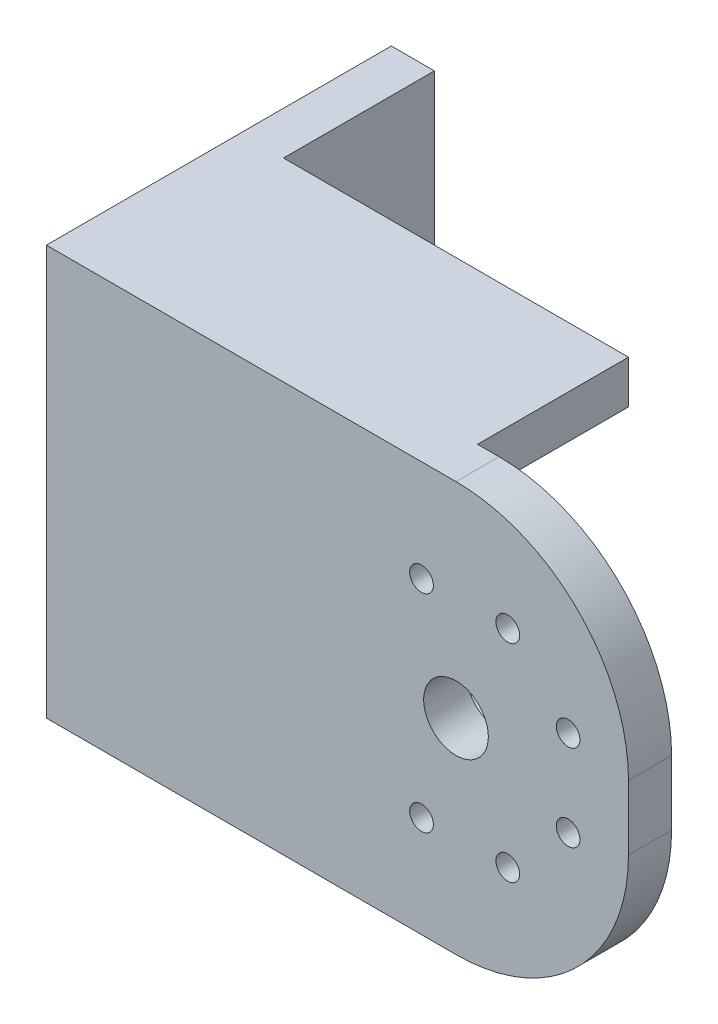
from build123d import *

# Parameters (mm, degrees)
SKETCH3_R           = 7.5
SKETCH3_R_2         = 2.75
BOSS_EXTRUDE1_DEPTH = 10
SKETCH4_W           = 10
SKETCH4_H           = 95
BOSS_EXTRUDE2_DEPTH = 70
SKETCH5_W           = 80
SKETCH5_H           = 10
BOSS_EXTRUDE3_DEPTH = 35
SKETCH8_R           = 7.5
SKETCH8_R_2         = 2.75
CUT_EXTRUDE2_DEPTH  = 43.8


with BuildPart() as part:
    # Sketch3 → Boss-Extrude1 (new body)
    with BuildSketch(Plane.XY):
        with BuildLine():
            Line((68.617133813, 80.05993294), (163.617133813, 80.05993294))
            ThreePointArc((163.617133813, 80.05993294), (191.90140506, 68.344204188), (203.617133813, 40.05993294))
            Line((203.617133813, 40.05993294), (203.617133813, 25.05993294))
            ThreePointArc((203.617133813, 25.05993294), (191.90140506, -3.224338307), (163.617133813, -14.94006706))
            Line((163.617133813, -14.94006706), (68.617133813, -14.94006706))
            Line((68.617133813, -14.94006706), (68.617133813, 80.05993294))
        make_face()
        with Locations((163.617133813, 32.55993294)):
            Circle(SKETCH3_R, mode=Mode.SUBTRACT)
        with Locations((189.617133813, 42.55993294)):
            Circle(SKETCH3_R_2, mode=Mode.SUBTRACT)
        with Locations((155.617133813, 56.55993294)):
            Circle(SKETCH3_R_2, mode=Mode.SUBTRACT)
        with Locations((175.617133813, 56.55993294)):
            Circle(SKETCH3_R_2, mode=Mode.SUBTRACT)
        with Locations((155.617133813, 8.55993294)):
            Circle(SKETCH3_R_2, mode=Mode.SUBTRACT)
        with Locations((175.617133813, 8.55993294)):
            Circle(SKETCH3_R_2, mode=Mode.SUBTRACT)
        with Locations((189.617133813, 22.55993294)):
            Circle(SKETCH3_R_2, mode=Mode.SUBTRACT)
    extrude(amount=BOSS_EXTRUDE1_DEPTH)

    # Sketch4 → Boss-Extrude2 (add)
    with BuildSketch(Plane(origin=(0, 0, 0), x_dir=(-1, 0, 0), z_dir=(0, 0, -1))):
        with Locations((-73.617133813, 32.55993294)):
            Rectangle(SKETCH4_W, SKETCH4_H)
    extrude(amount=BOSS_EXTRUDE2_DEPTH)

    # Sketch5 → Boss-Extrude3 (add)
    with BuildSketch(Plane(origin=(0, 0, 0), x_dir=(-1, 0, 0), z_dir=(0, 0, -1))):
        with Locations((-118.617133813, 75.05993294)):
            Rectangle(SKETCH5_W, SKETCH5_H)
        with Locations((-118.617133813, -9.94006706)):
            Rectangle(SKETCH5_W, SKETCH5_H)
    extrude(amount=BOSS_EXTRUDE3_DEPTH)

    # Sketch8 → Cut-Extrude2 (cut)
    with BuildSketch(Plane.ZY.offset(-68.617133813)):
        with Locations((-40, 32.55993294)):
            Circle(SKETCH8_R)
        with Locations((-56.167891819, 25.862972874)):
            Circle(SKETCH8_R_2)
        with Locations((-56.167891819, 39.256893006)):
            Circle(SKETCH8_R_2)
        with Locations((-46.696960066, 48.727824759)):
            Circle(SKETCH8_R_2)
        with Locations((-33.303039934, 48.727824759)):
            Circle(SKETCH8_R_2)
        with Locations((-23.832108181, 39.256893006)):
            Circle(SKETCH8_R_2)
        with Locations((-23.832108181, 25.862972874)):
            Circle(SKETCH8_R_2)
        with Locations((-33.303039934, 16.392041121)):
            Circle(SKETCH8_R_2)
        with Locations((-46.696960066, 16.392041121)):
            Circle(SKETCH8_R_2)
    extrude(amount=-CUT_EXTRUDE2_DEPTH, mode=Mode.SUBTRACT)


solid = part.part
